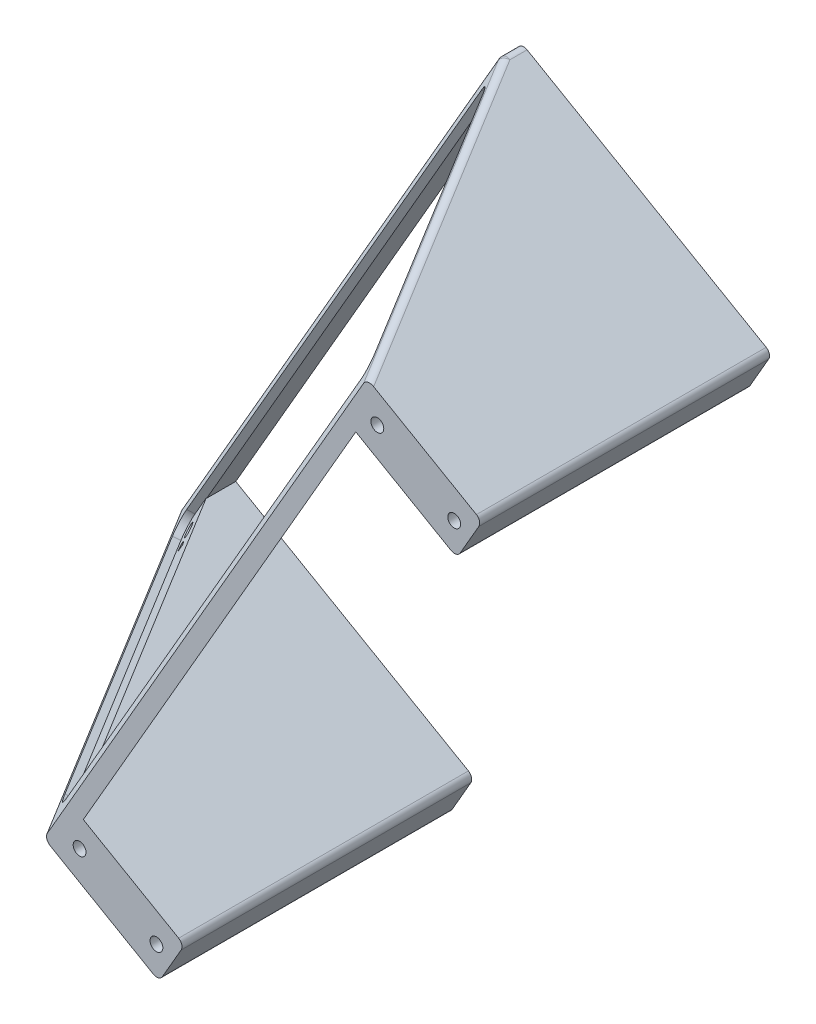
from build123d import *

# Parameters (mm, degrees)
BOSS_EXTRUDE1_DEPTH      = 65.5
CUT_EXTRUDE1_DEPTH       = 123.81081001013399
SKETCH5_W                = 286.8159556552996
SKETCH5_H                = 274.5057689508883
CUT_EXTRUDE2_DEPTH       = 124.35386359594037
FILLET1_R                = 1.5
SKETCH6_R                = 1.4499999999976838
SKETCH6_R_2              = 1.4499999999976672
CUT_EXTRUDE3_DEPTH       = 12.7
FILLET2_R                = 1.5
BOSS_EXTRUDE2_DEPTH      = 129.03199999999995
BOSS_EXTRUDE2_DEPTH_BACK = 6.35
FILLET3_R                = 1.5
SKETCH9_R                = 1.4499999999972695
SKETCH9_R_2              = 1.450000000000002
SKETCH9_R_3              = 1.44999999999727
SKETCH9_R_4              = 1.4500000000000004
CUT_EXTRUDE4_DEPTH       = 12.7
CUT_EXTRUDE5_START       = -12.7
SKETCH12_R               = 1.4500000000000008
SKETCH12_R_2             = 1.4499999999999993
SKETCH12_R_3             = 1.450000000000002
CUT_EXTRUDE5_DEPTH       = 12.7


with BuildPart() as part:
    # Sketch2 → Boss-Extrude1 (new body)
    with BuildSketch(Plane.XY):
        Polygon((-105.82469127018673, 132.22169365322222), (-100.10969127018673, 142.12036401847837), (-43.467299735665506, 109.41786401847837), (-49.1822997356655, 99.51919365322226), align=None)
    extrude(amount=BOSS_EXTRUDE1_DEPTH)

    # Sketch4 → Cut-Extrude1 (cut, through all)
    with BuildSketch(Plane(origin=(-102.92764878057318, 59.4253057305198, 68.61843252038122), x_dir=(-0.43301270189221336, 0.2499999999999988, -0.866025403784442), z_dir=(0.750000000000001, -0.4330127018922244, -0.4999999999999942))):
        with BuildLine():
            Line((12.055567275641103, -70.09999999999997), (68.18956727564095, -70.09999999999998))
            ThreePointArc((68.18956727564095, -70.09999999999998), (70.61140800120485, -69.0968407255639), (71.61456727564105, -66.675))
            Line((71.61456727564105, -66.675), (71.61456727564108, 66.67500000000005))
            ThreePointArc((71.61456727564108, 66.67500000000005), (70.611408001205, 69.096840725564), (68.18956727564107, 70.10000000000008))
            Line((68.18956727564107, 70.10000000000008), (12.055567275641172, 70.10000000000008))
            ThreePointArc((12.055567275641172, 70.10000000000008), (9.63372655007727, 69.096840725564), (8.630567275641152, 66.67500000000008))
            Line((8.630567275641152, 66.67500000000008), (8.630567275641091, -66.67499999999998))
            ThreePointArc((8.630567275641091, -66.67499999999998), (9.633726550077167, -69.09684072556392), (12.055567275641103, -70.09999999999997))
        make_face()
    extrude(amount=-CUT_EXTRUDE1_DEPTH, mode=Mode.SUBTRACT)

    # Sketch5 → Cut-Extrude2 (cut, through all)
    with BuildSketch(Plane(origin=(-104.07064878057318, 60.08521708820357, 69.38043252038125), x_dir=(0.43301270189221336, -0.2499999999999988, 0.866025403784442), z_dir=(-0.750000000000001, 0.43301270189222446, 0.4999999999999942))):
        with Locations((-47.42628955617079, -22.345577128817233)):
            Rectangle(SKETCH5_W, SKETCH5_H)
    extrude(amount=CUT_EXTRUDE2_DEPTH, mode=Mode.SUBTRACT)

    # Fillet1
    fillet1_edges = [part.edges().sort_by_distance(p)[0] for p in [
        (-43.467299735665506, 109.41786401847837, 32.75),
        (-84.80402815547504, 133.28363529907386, 34.88867377057616),
        (-76.11182953811208, 115.06696493381483, 63.70307100530266),
        (-49.1822997356655, 99.51919365322226, 32.75),
    ]]
    fillet(fillet1_edges, radius=FILLET1_R)

    # Sketch6 → Cut-Extrude3 (cut)
    with BuildSketch(Plane(origin=(-102.92764878057321, 59.42530573051982, 68.61843252038126), x_dir=(0.4330127018922132, -0.24999999999999897, 0.866025403784442), z_dir=(-0.750000000000001, 0.4330127018922244, 0.4999999999999942))):
        with Locations(Location((-12.4365672756387, 66.29527000000009, 0), (0, 0, 16.102113752))):
            Circle(SKETCH6_R)
        with Locations(Location((-67.80856727563872, 66.29527000000007, 0), (0, 0, 16.102113752))):
            Circle(SKETCH6_R_2)
    extrude(amount=-CUT_EXTRUDE3_DEPTH, mode=Mode.SUBTRACT)

    # Fillet2
    # the kernel refuses this fillet: 1.5 mm, written as the material it takes off along each edge
    with BuildSketch(Plane(origin=(-100.10969127018673, 142.12036401847837, -3.75), x_dir=(-0.5, -0.8660254037844387, 0), z_dir=(0, 0, 1))) as fillet2_piece_1:
        with BuildLine():
            CenterArc((FILLET2_R, FILLET2_R), FILLET2_R, 180, 90)
            Line((3e-17, FILLET2_R), (0, 0))
            Line((0, 0), (FILLET2_R, 0))
        make_face()
    extrude(amount=8.777347541152302, mode=Mode.SUBTRACT)


with BuildPart() as body_2:
    # Mirror2: mirrored copy
    add(part.part.mirror(Plane(origin=(0, 0, 0), x_dir=(1e-16, 1.8e-16, 1), z_dir=(0.500000000000004, 0.8660254037844364, 0))))


with BuildPart() as part_1:
    add(part.part)

    add(body_2.part)  # Boss-Extrude2 merges body 2
    # Sketch8 → Boss-Extrude2 (add, two sides: drawn at the far end of the back side and taken through both)
    with BuildSketch(Plane(origin=(30.797500000000397, 53.34283474610328, 0), x_dir=(0.866025403784437, -0.5000000000000029, 0), z_dir=(-0.5000000000000029, -0.866025403784437, 0)).offset(-BOSS_EXTRUDE2_DEPTH_BACK)):
        Polygon((-154.5827178142381, 6.554994353133541), (-155.97771781422597, 7.360397978646052), (-157.7577178142381, 4.277347541152373), (-157.7577178142381, 0), (-154.58271781423835, 0), align=None)
        Polygon((-123.18667970854972, 61.15614201060529), (-121.73608733433291, 60.31864170382078), (-118.74462872726596, 65.50000000000001), (-120.67875212905116, 65.50000000000001), (-122.41080293662007, 65.50000000000001), (-124.48571781422638, 61.90614201060528), align=None)
    extrude(amount=BOSS_EXTRUDE2_DEPTH + BOSS_EXTRUDE2_DEPTH_BACK)

    # Fillet3
    fillet3_edges = [part_1.edges().sort_by_distance(p)[0] for p in [
        (-172.53112429253738, 15.785626111925975, 4.1571540602531725),
        (-136.62219127018705, 78.87885890711985, 4.277347541152341),
        (-99.93631537383828, 141.5235235248658, 4.157154060253142),
    ]]
    fillet(fillet3_edges, radius=FILLET3_R)

    # Sketch9 → Cut-Extrude4 (cut)
    with BuildSketch(Plane.XY.offset(65.50000000000001)):
        with Locations((-67.1597126180574, 116.49757139704164)):
            Circle(SKETCH9_R)
        with Locations((-49.7889013508033, 106.4685288358503)):
            Circle(SKETCH9_R_2)
        with Locations((-134.46971261805777, -0.08676846042013409)):
            Circle(SKETCH9_R_3)
        with Locations((-117.0989013508037, -10.115811021611455)):
            Circle(SKETCH9_R_4)
    extrude(amount=-CUT_EXTRUDE4_DEPTH, mode=Mode.SUBTRACT)

    # Sketch12 → Cut-Extrude5 (cut)
    with BuildSketch(Plane(origin=(0, 0, 0), x_dir=(-1, 0, 0), z_dir=(0, 0, -1)).offset(CUT_EXTRUDE5_START)):
        with Locations((163.84262252006926, 16.871688978388832)):
            Circle(SKETCH12_R)
        with Locations(Location((117.09890135080418, -10.115811021611187, 0), (0, 0, 180))):
            Circle(SKETCH12_R_2)
        with Locations((96.53262252006812, 133.4560288358508)):
            Circle(SKETCH12_R_3)
        with Locations(Location((49.78890135080324, 106.46852883585038, 0), (0, 0, 180))):
            Circle(SKETCH12_R_3)
    extrude(amount=CUT_EXTRUDE5_DEPTH, mode=Mode.SUBTRACT)


solid = part_1.part
